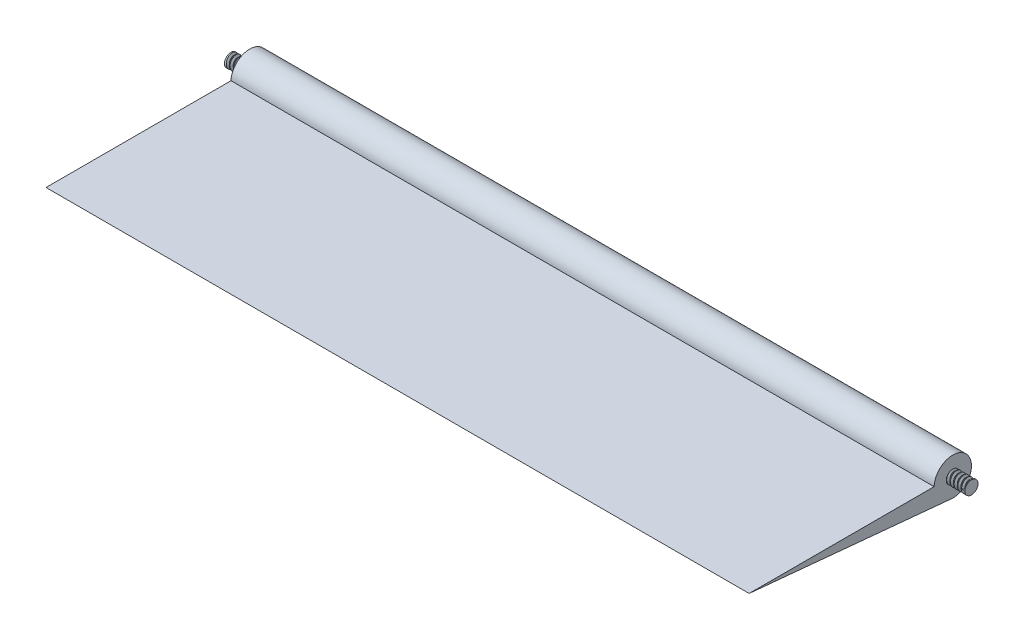
from build123d import *

# Parameters (mm, degrees)
SKETCH2_R           = 6.35
BOSS_EXTRUDE2_DEPTH = 477.9518
BOSS_EXTRUDE3_START = -238.9759
SKETCH3_R           = 12.7
BOSS_EXTRUDE3_DEPTH = 477.9518
SKETCH4_R           = 4.445
BOSS_EXTRUDE4_DEPTH = 12.7
THREAD1_PITCH       = 2.54
THREAD2_PITCH       = 2.54


with BuildPart() as part:
    # Sketch2 → Boss-Extrude2 (new body)
    with BuildSketch(Plane(origin=(0, 0, 0), x_dir=(0, 0, -1), z_dir=(1, 0, 0))):
        with BuildLine():
            Line((-138.43, 0.424853416), (-12.692891695, 0.424853416))
            ThreePointArc((-12.692891695, 0.424853416), (-8.828770062, 9.129228839), (0, 12.7))
            ThreePointArc((0, 12.7), (12.7, 0), (0, -12.7))
            Line((0, -12.7), (-138.43, 0.424853416))
        make_face()
        Circle(SKETCH2_R, mode=Mode.SUBTRACT)
    extrude(amount=BOSS_EXTRUDE2_DEPTH)

    # Sketch3 → Boss-Extrude3 (add)
    with BuildSketch(Plane.ZY.offset(-238.9759).offset(BOSS_EXTRUDE3_START)):
        Circle(SKETCH3_R)
    extrude(amount=BOSS_EXTRUDE3_DEPTH)

    # Sketch4 → Boss-Extrude4 (add)
    with BuildSketch(Plane.ZY):
        Circle(SKETCH4_R)
    boss_extrude4 = extrude(amount=BOSS_EXTRUDE4_DEPTH)

    # Thread1: the profile of Thread Profile1 profile screwed along a right-hand helix of 5 turns, 10 arcs to a turn; built about Z, then put on its axis
    thread1_z = Axis((0, 0, 0), (0, 0, 1))
    thread1_corners = [(4.4453, 0, -0.000173205), (4.4453, 0, 2.222673198), (3.070184677, 0, 1.428749997), (3.070184677, 0, 0.793749997)]
    with BuildLine(mode=Mode.PRIVATE) as thread1_profile:
        Line(thread1_corners[0], thread1_corners[1])
        Line(thread1_corners[1], thread1_corners[2])
        Line(thread1_corners[2], thread1_corners[3])
        Line(thread1_corners[3], thread1_corners[0])
    thread1_cap = Face(thread1_profile.wire())
    thread1_turn_angles = [0, 18, 36, 54, 72, 90, 108, 126, 144, 162, 180, 198, 216, 234, 252, 270, 288, 306, 324, 342, 360]
    thread1_turn_weights = [1, 0.9510565162951535, 1, 0.9510565162951535, 1, 0.9510565162951535, 1, 0.9510565162951535, 1, 0.9510565162951535, 1, 0.9510565162951535, 1, 0.9510565162951535, 1, 0.9510565162951535, 1, 0.9510565162951535, 1, 0.9510565162951535, 1]
    thread1_turn_rails = [Edge.make_bspline([Vector(p[0], p[1], 0).rotate(thread1_z, thread1_turn_angles[k]) / thread1_turn_weights[k] + Vector(0, 0, p[2] + THREAD1_PITCH * thread1_turn_angles[k] / 360) for k in range(21)], [0, 0, 0, 1, 1, 2, 2, 3, 3, 4, 4, 5, 5, 6, 6, 7, 7, 8, 8, 9, 9, 10, 10, 10], 2, thread1_turn_weights) for p in thread1_corners]
    thread1_turn_sides = [Face.make_surface_from_curves(thread1_turn_rails[p[0]], thread1_turn_rails[p[1]]) for p in [(0, 1), (1, 2), (2, 3), (3, 0)]]
    thread1 = Plane(origin=(-12.7, 0, 0), x_dir=(0, 0, -1), z_dir=(1, 0, 0)) * Solid(Shell([*[p.moved(Location((0, 0, THREAD1_PITCH * i))) for i in range(5) for p in thread1_turn_sides], thread1_cap, thread1_cap.rotate(thread1_z, 1800).moved(Location((0, 0, THREAD1_PITCH * 1800 / 360)))]))
    add(thread1, mode=Mode.SUBTRACT)

    # Mirror3: Boss-Extrude4 across plane
    add(boss_extrude4.mirror(Plane.ZY.offset(-238.9759)))

    # Thread2: the profile of Thread Profile2 profile screwed along a right-hand helix of 5 turns, 10 arcs to a turn; built about Z, then put on its axis
    thread2_z = Axis((0, 0, 0), (0, 0, 1))
    thread2_corners = [(4.4453, 0, -0.000173205), (4.4453, 0, 2.222673198), (3.070184677, 0, 1.428749997), (3.070184677, 0, 0.793749997)]
    with BuildLine(mode=Mode.PRIVATE) as thread2_profile:
        Line(thread2_corners[0], thread2_corners[1])
        Line(thread2_corners[1], thread2_corners[2])
        Line(thread2_corners[2], thread2_corners[3])
        Line(thread2_corners[3], thread2_corners[0])
    thread2_cap = Face(thread2_profile.wire())
    thread2_turn_angles = [0, 18, 36, 54, 72, 90, 108, 126, 144, 162, 180, 198, 216, 234, 252, 270, 288, 306, 324, 342, 360]
    thread2_turn_weights = [1, 0.9510565162951535, 1, 0.9510565162951535, 1, 0.9510565162951535, 1, 0.9510565162951535, 1, 0.9510565162951535, 1, 0.9510565162951535, 1, 0.9510565162951535, 1, 0.9510565162951535, 1, 0.9510565162951535, 1, 0.9510565162951535, 1]
    thread2_turn_rails = [Edge.make_bspline([Vector(p[0], p[1], 0).rotate(thread2_z, thread2_turn_angles[k]) / thread2_turn_weights[k] + Vector(0, 0, p[2] + THREAD2_PITCH * thread2_turn_angles[k] / 360) for k in range(21)], [0, 0, 0, 1, 1, 2, 2, 3, 3, 4, 4, 5, 5, 6, 6, 7, 7, 8, 8, 9, 9, 10, 10, 10], 2, thread2_turn_weights) for p in thread2_corners]
    thread2_turn_sides = [Face.make_surface_from_curves(thread2_turn_rails[p[0]], thread2_turn_rails[p[1]]) for p in [(0, 1), (1, 2), (2, 3), (3, 0)]]
    thread2 = Plane(origin=(490.6518, 0, 0), x_dir=(0, 0, 1), z_dir=(-1, 0, 0)) * Solid(Shell([*[p.moved(Location((0, 0, THREAD2_PITCH * i))) for i in range(5) for p in thread2_turn_sides], thread2_cap, thread2_cap.rotate(thread2_z, 1800).moved(Location((0, 0, THREAD2_PITCH * 1800 / 360)))]))
    add(thread2, mode=Mode.SUBTRACT)


solid = part.part
